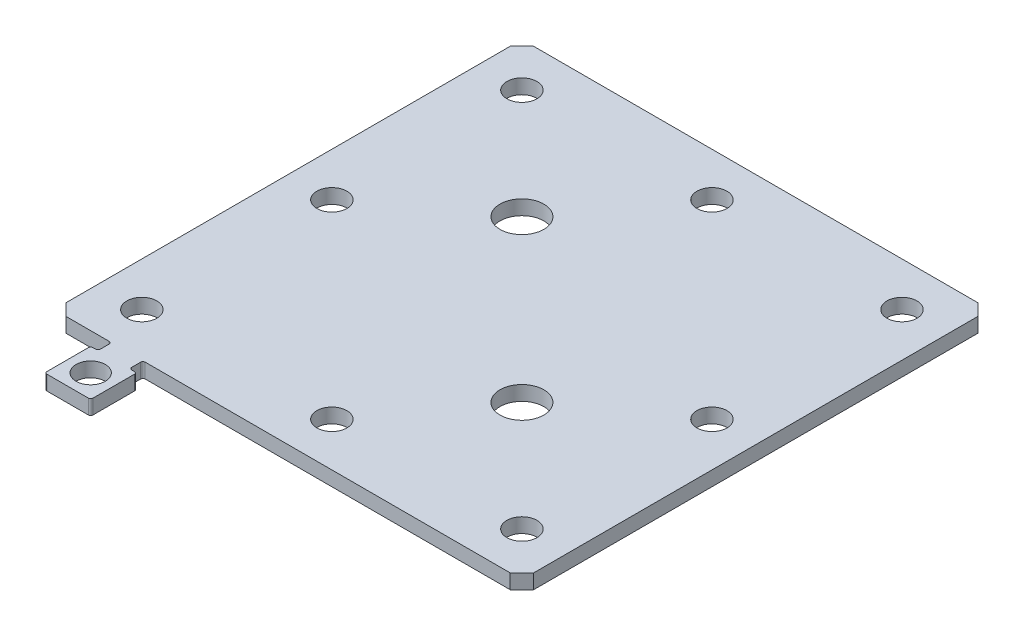
from build123d import *

# Parameters (mm, degrees)
SKETCH1_R           = 3.2639
BOSS_EXTRUDE1_DEPTH = 3.175
FILLET1_R           = 0.5
SKETCH2_R           = 3.175
SKETCH2_R_2         = 4.7625
CUT_EXTRUDE2_DEPTH  = 82.473297996


with BuildPart() as part:
    # Sketch1 → Boss-Extrude1 (new body)
    with BuildSketch(Plane(origin=(0, 0, 0), x_dir=(1, 0, 0), z_dir=(0, 1, 0))):
        Polygon((-48.883629421, 51.423629421), (-51.423629421, 48.883629421), (-51.423629421, -47.636370579), (-48.883629421, -50.176370579), (-38.961129421, -50.176370579), (-38.961129421, -53.11440405), (-40.548629421, -53.11440405), (-40.548629421, -63.11440405), (-30.548629421, -63.11440405), (-30.548629421, -53.11440405), (-32.136129421, -53.11440405), (-32.136129421, -50.176370579), (47.636370579, -50.176370579), (50.176370579, -47.636370579), (50.176370579, 48.883629421), (47.636370579, 51.423629421), align=None)
        with Locations((-41.898629421, -40.651370579)):
            Circle(SKETCH1_R, mode=Mode.SUBTRACT)
        with Locations((-0.623629421, -40.651370579)):
            Circle(SKETCH1_R, mode=Mode.SUBTRACT)
        with Locations((40.651370579, -40.651370579)):
            Circle(SKETCH1_R, mode=Mode.SUBTRACT)
        with Locations((-41.898629421, 0.623629421)):
            Circle(SKETCH1_R, mode=Mode.SUBTRACT)
        with Locations((-41.898629421, 41.898629421)):
            Circle(SKETCH1_R, mode=Mode.SUBTRACT)
        with Locations((-0.623629421, 41.898629421)):
            Circle(SKETCH1_R, mode=Mode.SUBTRACT)
        with Locations((40.651370579, 0.623629421)):
            Circle(SKETCH1_R, mode=Mode.SUBTRACT)
        with Locations((40.651370579, 41.898629421)):
            Circle(SKETCH1_R, mode=Mode.SUBTRACT)
    extrude(amount=BOSS_EXTRUDE1_DEPTH)

    # Fillet1
    fillet1_edges = [part.edges().sort_by_distance(p)[0] for p in [
        (-40.548629421, 1.5875, 63.11440405),
        (-30.548629421, 1.5875, 63.11440405),
        (-30.548629421, 1.5875, 53.11440405),
        (-32.136129421, 1.5875, 53.11440405),
        (-32.136129421, 1.5875, 50.176370579),
        (-40.548629421, 1.5875, 53.11440405),
        (-38.961129421, 1.5875, 53.11440405),
        (-38.961129421, 1.5875, 50.176370579),
    ]]
    fillet(fillet1_edges, radius=FILLET1_R)

    # Sketch2 → Cut-Extrude2 (cut, through all)
    with BuildSketch(Plane(origin=(0, 3.175, 0), x_dir=(1, 0, 0), z_dir=(0, 1, 0))):
        with Locations((-35.548629421, -58.11440405)):
            Circle(SKETCH2_R)
        with Locations((-18.086129421, 18.086129421)):
            Circle(SKETCH2_R_2)
        with Locations((16.838870579, -16.838870579)):
            Circle(SKETCH2_R_2)
    extrude(amount=-CUT_EXTRUDE2_DEPTH, mode=Mode.SUBTRACT)


solid = part.part
